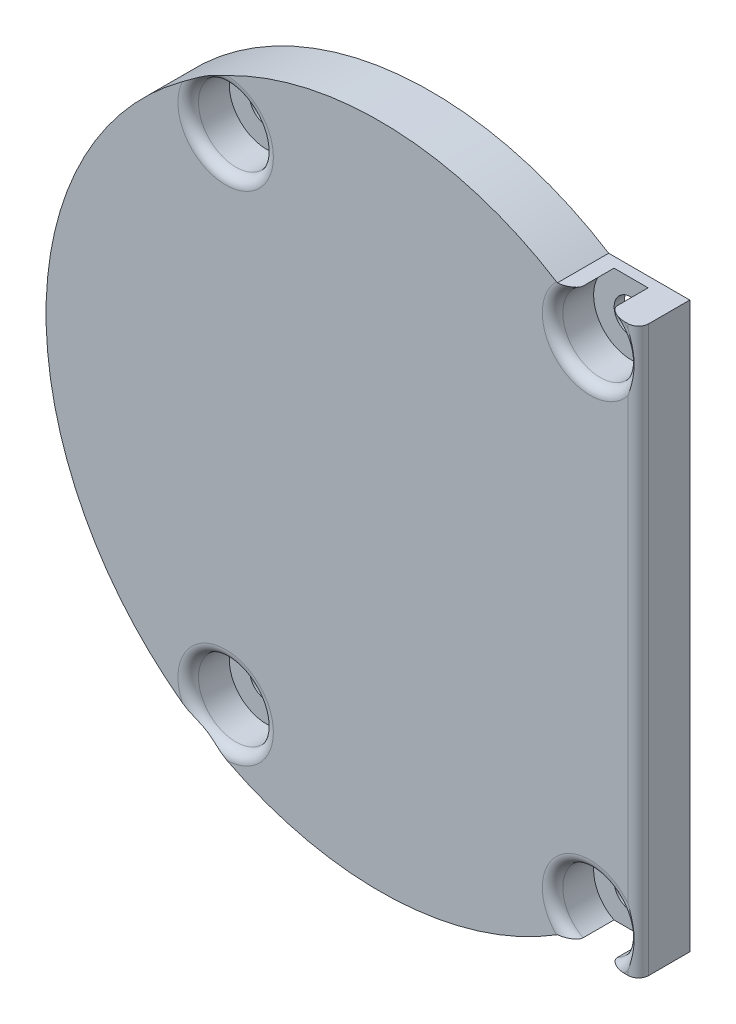
from build123d import *

# Parameters (mm, degrees)
SKIZZE1_R                       = 1.65
AUFSATZ_LINEAR_AUSTRAGEN1_DEPTH = 5
SKIZZE2_R                       = 3.65
SCHNITT_LINEAR_AUSTRAGEN1_DEPTH = 4
VERRUNDUNG10_R                  = 1


with BuildPart() as part:
    # Skizze1 → Aufsatz-Linear austragen1 (new body)
    with BuildSketch(Plane.XY):
        with BuildLine():
            Line((25.22, 27.5), (17.320508076, 27.5))
            ThreePointArc((17.320508076, 27.5), (-32.5, 0), (17.320508076, -27.5))
            Line((17.320508076, -27.5), (25.22, -27.5))
            Line((25.22, -27.5), (25.22, 27.5))
        make_face()
        with Locations((20.5, -24.25)):
            Circle(SKIZZE1_R, mode=Mode.SUBTRACT)
        with Locations((20.5, 24.25)):
            Circle(SKIZZE1_R, mode=Mode.SUBTRACT)
        with Locations((-15, -24.25)):
            Circle(SKIZZE1_R, mode=Mode.SUBTRACT)
        with Locations((-15, 24.25)):
            Circle(SKIZZE1_R, mode=Mode.SUBTRACT)
    extrude(amount=AUFSATZ_LINEAR_AUSTRAGEN1_DEPTH)

    # Skizze2 → Schnitt-Linear austragen1 (cut)
    with BuildSketch(Plane.XY.offset(5)):
        with Locations((-15, 24.25)):
            Circle(SKIZZE2_R)
        with Locations((20.5, 24.25)):
            Circle(SKIZZE2_R)
        with Locations((20.5, -24.25)):
            Circle(SKIZZE2_R)
        with Locations(Location((-15, -24.25, 0), (0, 0, 180))):
            Circle(SKIZZE2_R)
    extrude(amount=-SCHNITT_LINEAR_AUSTRAGEN1_DEPTH, mode=Mode.SUBTRACT)

    # Verrundung10
    # the kernel refuses this fillet: 1 mm, written as the material it takes off along each edge
    with BuildSketch(Plane(origin=(25.22, -30, 5), x_dir=(-1, 0, 0), z_dir=(0, 1, 0))) as verrundung10_piece_1:
        with BuildLine():
            CenterArc((VERRUNDUNG10_R, -VERRUNDUNG10_R), VERRUNDUNG10_R, 90, 90)
            Line((0, -VERRUNDUNG10_R), (0, 0))
            Line((0, 0), (VERRUNDUNG10_R, 0))
        make_face()
    extrude(amount=60, mode=Mode.SUBTRACT)
    with BuildSketch(Plane(origin=(20.5, 24.25, 5), x_dir=(0.0031415874858533787, 0.9999950652018582, 0), z_dir=(-0.9999950652018582, 0.0031415874858533787, 0))) as verrundung10_piece_2:
        with BuildLine():
            CenterArc((3.65 + VERRUNDUNG10_R, VERRUNDUNG10_R), VERRUNDUNG10_R, 180, 90)
            Line((3.65 + VERRUNDUNG10_R, 0), (3.65, 0))
            Line((3.65, 0), (3.65, VERRUNDUNG10_R))
        make_face()
    revolve(axis=Axis((20.5, 24.25, 5), (0, 0, -1)), revolution_arc=359.64, mode=Mode.SUBTRACT)
    with BuildSketch(Plane(origin=(20.5, -24.25, 5), x_dir=(-0.0031415874859059387, -0.999995065201858, 0), z_dir=(0.999995065201858, -0.0031415874859059387, 0))) as verrundung10_piece_3:
        with BuildLine():
            CenterArc((3.65 + VERRUNDUNG10_R, VERRUNDUNG10_R), VERRUNDUNG10_R, 180, 90)
            Line((3.65 + VERRUNDUNG10_R, 0), (3.65, 0))
            Line((3.65, 0), (3.65, VERRUNDUNG10_R))
        make_face()
    revolve(axis=Axis((20.5, -24.25, 5), (0, 0, -1)), revolution_arc=359.64, mode=Mode.SUBTRACT)
    with BuildSketch(Plane(origin=(-15, -24.25, 5), x_dir=(-1, 0, 0), z_dir=(0, 1, 0))) as verrundung10_piece_4:
        with BuildLine():
            CenterArc((3.65 + VERRUNDUNG10_R, -VERRUNDUNG10_R), VERRUNDUNG10_R, 90, 90)
            Line((3.65, -VERRUNDUNG10_R), (3.65, 0))
            Line((3.65, 0), (3.65 + VERRUNDUNG10_R, 0))
        make_face()
    revolve(axis=Axis((-15, -24.25, 5), (0, 0, 1)), mode=Mode.SUBTRACT)
    with BuildSketch(Plane(origin=(-15, 24.25, 5), x_dir=(1, 0, 0), z_dir=(0, -1, 0))) as verrundung10_piece_5:
        with BuildLine():
            CenterArc((3.65 + VERRUNDUNG10_R, -VERRUNDUNG10_R), VERRUNDUNG10_R, 90, 90)
            Line((3.65, -VERRUNDUNG10_R), (3.65, 0))
            Line((3.65, 0), (3.65 + VERRUNDUNG10_R, 0))
        make_face()
    revolve(axis=Axis((-15, 24.25, 5), (0, 0, 1)), mode=Mode.SUBTRACT)


solid = part.part
